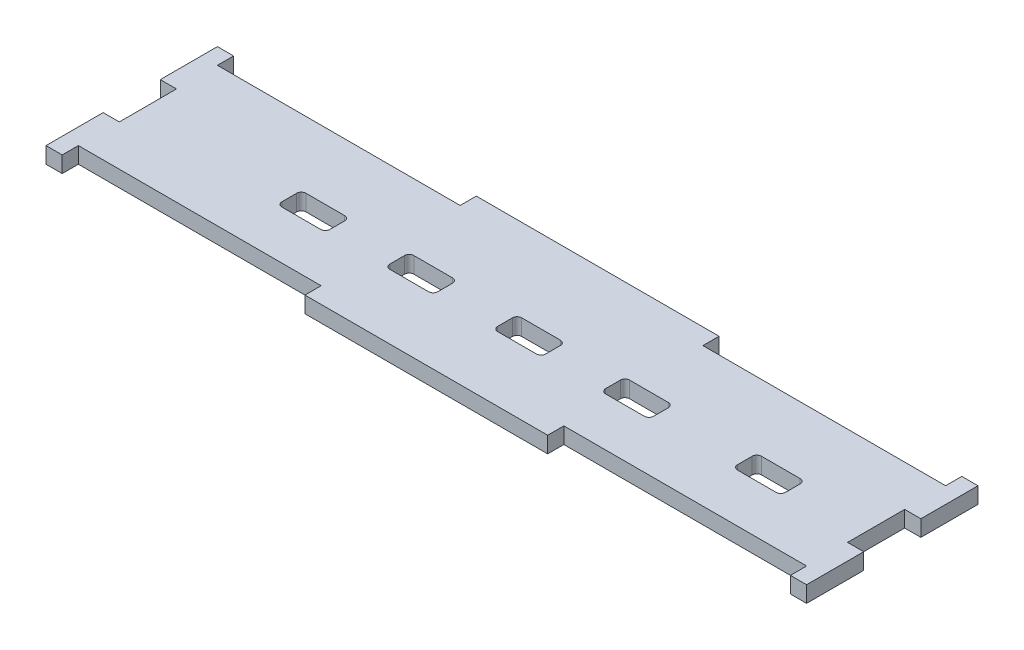
from build123d import *

# Parameters (mm, degrees)
BOSS_EXTRUDE1_DEPTH = 2.7


with BuildPart() as part:
    # Sketch1 → Boss-Extrude1 (new body)
    with BuildSketch(Plane(origin=(0, 0, 0), x_dir=(1, 0, 0), z_dir=(0, 1, 0))):
        Polygon((4, 2.833333333), (4, 12.366666667), (6.7, 12.366666667), (6.7, 21.9), (4, 21.9), (4, 19.2), (-36.5, 19.2), (-36.5, 21.9), (-77, 21.9), (-77, 19.2), (-117.5, 19.2), (-117.5, 21.9), (-120.2, 21.9), (-120.2, 12.366666667), (-117.5, 12.366666667), (-117.5, 2.833333333), (-120.2, 2.833333333), (-120.2, -6.7), (-117.5, -6.7), (-117.5, -4), (-77, -4), (-77, -6.7), (-36.5, -6.7), (-36.5, -4), (4, -4), (4, -6.7), (6.7, -6.7), (6.7, 2.833333333), align=None)
        with BuildLine():
            Line((-91.627899854, 8.1), (-85.172100146, 8.1))
            ThreePointArc((-85.172100146, 8.1), (-84.626142897, 7.873857103), (-84.4, 7.327899854))
            Line((-84.4, 7.327899854), (-84.4, 4.872100146))
            ThreePointArc((-84.4, 4.872100146), (-84.626142897, 4.326142897), (-85.172100146, 4.1))
            Line((-85.172100146, 4.1), (-91.627899854, 4.1))
            ThreePointArc((-91.627899854, 4.1), (-92.173857103, 4.326142897), (-92.4, 4.872100146))
            Line((-92.4, 4.872100146), (-92.4, 7.327899854))
            ThreePointArc((-92.4, 7.327899854), (-92.173857103, 7.873857103), (-91.627899854, 8.1))
        make_face(mode=Mode.SUBTRACT)
        with BuildLine():
            Line((-73.627899854, 8.1), (-67.172100146, 8.1))
            ThreePointArc((-67.172100146, 8.1), (-66.626142897, 7.873857103), (-66.4, 7.327899854))
            Line((-66.4, 7.327899854), (-66.4, 4.872100146))
            ThreePointArc((-66.4, 4.872100146), (-66.626142897, 4.326142897), (-67.172100146, 4.1))
            Line((-67.172100146, 4.1), (-73.627899854, 4.1))
            ThreePointArc((-73.627899854, 4.1), (-74.173857103, 4.326142897), (-74.4, 4.872100146))
            Line((-74.4, 4.872100146), (-74.4, 7.327899854))
            ThreePointArc((-74.4, 7.327899854), (-74.173857103, 7.873857103), (-73.627899854, 8.1))
        make_face(mode=Mode.SUBTRACT)
        with BuildLine():
            Line((-55.627899854, 8.1), (-49.172100146, 8.1))
            ThreePointArc((-49.172100146, 8.1), (-48.626142897, 7.873857103), (-48.4, 7.327899854))
            Line((-48.4, 7.327899854), (-48.4, 4.872100146))
            ThreePointArc((-48.4, 4.872100146), (-48.626142897, 4.326142897), (-49.172100146, 4.1))
            Line((-49.172100146, 4.1), (-55.627899854, 4.1))
            ThreePointArc((-55.627899854, 4.1), (-56.173857103, 4.326142897), (-56.4, 4.872100146))
            Line((-56.4, 4.872100146), (-56.4, 7.327899854))
            ThreePointArc((-56.4, 7.327899854), (-56.173857103, 7.873857103), (-55.627899854, 8.1))
        make_face(mode=Mode.SUBTRACT)
        with BuildLine():
            Line((-37.627899854, 8.1), (-31.172100146, 8.1))
            ThreePointArc((-31.172100146, 8.1), (-30.626142897, 7.873857103), (-30.4, 7.327899854))
            Line((-30.4, 7.327899854), (-30.4, 4.872100146))
            ThreePointArc((-30.4, 4.872100146), (-30.626142897, 4.326142897), (-31.172100146, 4.1))
            Line((-31.172100146, 4.1), (-37.627899854, 4.1))
            ThreePointArc((-37.627899854, 4.1), (-38.173857103, 4.326142897), (-38.4, 4.872100146))
            Line((-38.4, 4.872100146), (-38.4, 7.327899854))
            ThreePointArc((-38.4, 7.327899854), (-38.173857103, 7.873857103), (-37.627899854, 8.1))
        make_face(mode=Mode.SUBTRACT)
        with BuildLine():
            Line((-15.627899854, 8.1), (-9.172100146, 8.1))
            ThreePointArc((-9.172100146, 8.1), (-8.626142897, 7.873857103), (-8.4, 7.327899854))
            Line((-8.4, 7.327899854), (-8.4, 4.872100146))
            ThreePointArc((-8.4, 4.872100146), (-8.626142897, 4.326142897), (-9.172100146, 4.1))
            Line((-9.172100146, 4.1), (-15.627899854, 4.1))
            ThreePointArc((-15.627899854, 4.1), (-16.173857103, 4.326142897), (-16.4, 4.872100146))
            Line((-16.4, 4.872100146), (-16.4, 7.327899854))
            ThreePointArc((-16.4, 7.327899854), (-16.173857103, 7.873857103), (-15.627899854, 8.1))
        make_face(mode=Mode.SUBTRACT)
    extrude(amount=BOSS_EXTRUDE1_DEPTH)


solid = part.part
